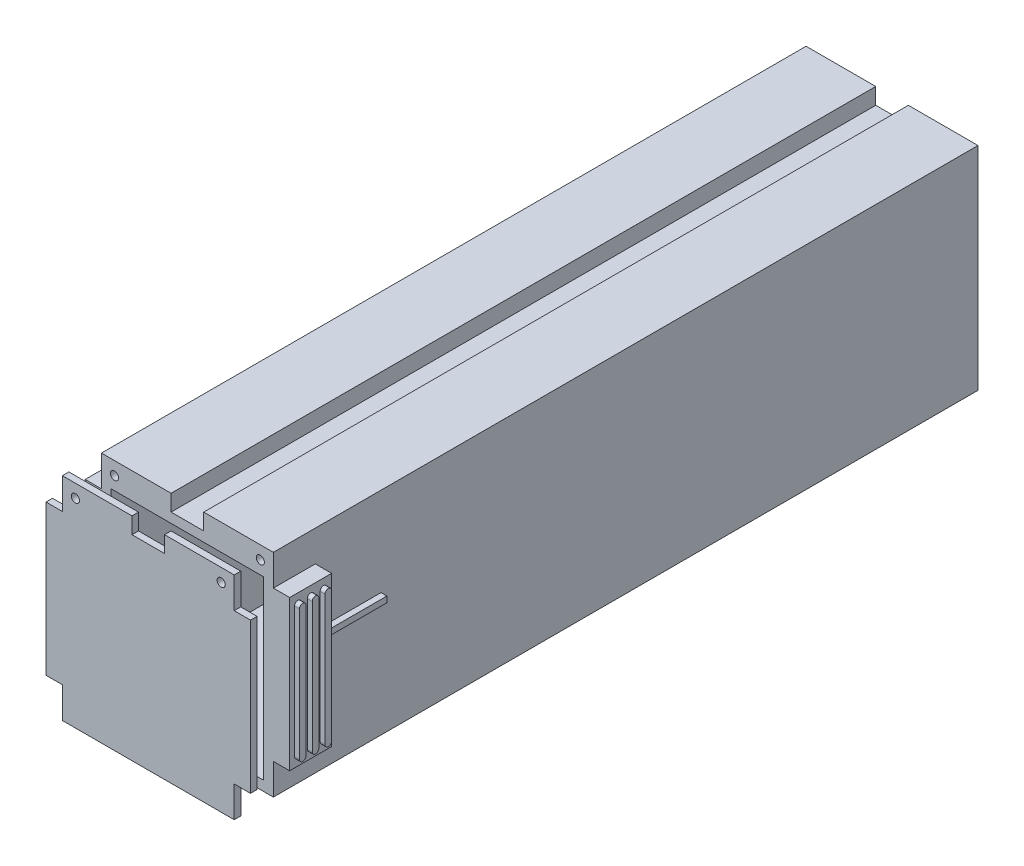
from build123d import *

# Parameters (mm, degrees)
SKETCH_1_W             = 52.7
SKETCH_1_H             = 65
EXTRUDE_1_DEPTH        = 216
SKETCH_2_W             = 10
SKETCH_2_H             = 5
CUT_EXTRUDE_1_DEPTH    = 232.642591075
SKETCH_3_W             = 46.7
SKETCH_3_H             = 54
CUT_EXTRUDE_2_DEPTH    = 211
SKETCH_6_R             = 1.75
SKETCH_6_W             = 16
SKETCH_6_H             = 16
CUT_EXTRUDE_3_DEPTH    = 5
SKETCH_7_W             = 1.8
SKETCH_7_H             = 1.8
EXTRUDE_2_DEPTH        = 33
SKETCH_9_W             = 12.85
SKETCH_9_H             = 46
EXTRUDE_3_DEPTH        = 5
SKETCH_10_W            = 12.85
SKETCH_10_H            = 46
EXTRUDE_4_DEPTH        = 5
EXTRUDE_5_DEPTH        = 1.5
EXTRUDE_START          = 1.5
EXTRUDE_6_DEPTH        = 1.5
EXTRUDE_7_DEPTH        = 2
SKETCH_15_R            = 1.25
CUT_EXTRUDE_4_DEPTH    = 20
SPLIT_START            = 57.7
SPLIT_BODIES_1_DEPTH   = 1.5
SPLIT_BODIES_1_2_DEPTH = 1.5
SPLIT_BODIES_1_3_DEPTH = 1.5
SPLIT_START_2          = -6.5
SPLIT_BODIES_1_4_DEPTH = 1.5
SPLIT_BODIES_1_5_DEPTH = 1.5
SPLIT_BODIES_1_6_DEPTH = 1.5
SPLIT_BODIES_1_7_DEPTH = 1.5
SPLIT_BODIES_1_8_DEPTH = 1.5


# Read off the part's stored shape, not the designer's step: 分割1
with BuildPart() as part:
    # 草图1 → 凸台-拉伸1 (new body)
    with BuildSketch(Plane.XY):
        with Locations((26.35, 32.5)):
            Rectangle(SKETCH_1_W, SKETCH_1_H)
    extrude(amount=EXTRUDE_1_DEPTH)

    # 草图2 → 切除-拉伸1 (cut, through all)
    with BuildSketch(Plane.XY.offset(216)):
        with Locations((26.35, 62.5)):
            Rectangle(SKETCH_2_W, SKETCH_2_H)
    extrude(amount=-CUT_EXTRUDE_1_DEPTH, mode=Mode.SUBTRACT)

    # 草图3 → 切除-拉伸2 (cut)
    with BuildSketch(Plane.XY.offset(216)):
        with Locations((26.35, 30)):
            Rectangle(SKETCH_3_W, SKETCH_3_H)
    extrude(amount=-CUT_EXTRUDE_2_DEPTH, mode=Mode.SUBTRACT)

    # 草图6 → 切除-拉伸3 (cut)
    with BuildSketch(Plane(origin=(0, 0, 0), x_dir=(-1, 0, 0), z_dir=(0, 0, -1))):
        with Locations((-13.6, 14.2)):
            Circle(SKETCH_6_R)
        with Locations((-39.1, 14.2)):
            Circle(SKETCH_6_R)
        with Locations((-26.35, 14.2)):
            Rectangle(SKETCH_6_W, SKETCH_6_H)
    extrude(amount=-CUT_EXTRUDE_3_DEPTH, mode=Mode.SUBTRACT)

    # 草图7 → 凸台-拉伸2 (add)
    with BuildSketch(Plane.XY.offset(216)):
        with Locations((53.6, 36.9)):
            Rectangle(SKETCH_7_W, SKETCH_7_H)
    extrude(amount=-EXTRUDE_2_DEPTH)

    # 草图9 → 凸台-拉伸3 (add)
    with BuildSketch(Plane.ZY):
        with Locations((209.575, 32.5)):
            Rectangle(SKETCH_9_W, SKETCH_9_H)
    extrude(amount=EXTRUDE_3_DEPTH)

    # 草图10 → 凸台-拉伸4 (add)
    with BuildSketch(Plane(origin=(52.7, 0, 0), x_dir=(0, 0, -1), z_dir=(1, 0, 0))):
        with Locations((-209.575, 32.5)):
            Rectangle(SKETCH_10_W, SKETCH_10_H)
    extrude(amount=EXTRUDE_4_DEPTH)

    # 草图11 → 凸台-拉伸5 (add)
    with BuildSketch(Plane(origin=(57.7, 0, 0), x_dir=(0, 0, -1), z_dir=(1, 0, 0))):
        with BuildLine():
            Line((-214.5, 12.5), (-214.5, 52.5))
            ThreePointArc((-214.5, 52.5), (-213.5, 53.5), (-212.5, 52.5))
            Line((-212.5, 52.5), (-212.5, 12.5))
            ThreePointArc((-212.5, 12.5), (-213.5, 11.5), (-214.5, 12.5))
        make_face()
        with BuildLine():
            Line((-210.575, 12.5), (-210.575, 52.5))
            ThreePointArc((-210.575, 52.5), (-209.575, 53.5), (-208.575, 52.5))
            Line((-208.575, 52.5), (-208.575, 12.5))
            ThreePointArc((-208.575, 12.5), (-209.575, 11.5), (-210.575, 12.5))
        make_face()
        with BuildLine():
            Line((-206.65, 12.5), (-206.65, 52.5))
            ThreePointArc((-206.65, 52.5), (-205.65, 53.5), (-204.65, 52.5))
            Line((-204.65, 52.5), (-204.65, 12.5))
            ThreePointArc((-204.65, 12.5), (-205.65, 11.5), (-206.65, 12.5))
        make_face()
    extrude(amount=EXTRUDE_5_DEPTH)

    # 草图12 → 凸台-拉伸6 (add)
    with BuildSketch(Plane.ZY.offset(5).offset(EXTRUDE_START)):
        with BuildLine():
            Line((214.5, 12.5), (214.5, 52.5))
            ThreePointArc((214.5, 52.5), (213.5, 53.5), (212.5, 52.5))
            Line((212.5, 52.5), (212.5, 12.5))
            ThreePointArc((212.5, 12.5), (213.5, 11.5), (214.5, 12.5))
        make_face()
        with BuildLine():
            Line((206.65, 12.5), (206.65, 52.5))
            ThreePointArc((206.65, 52.5), (205.65, 53.5), (204.65, 52.5))
            Line((204.65, 52.5), (204.65, 12.5))
            ThreePointArc((204.65, 12.5), (205.65, 11.5), (206.65, 12.5))
        make_face()
        with BuildLine():
            Line((210.575, 12.5), (210.575, 52.5))
            ThreePointArc((210.575, 52.5), (209.575, 53.5), (208.575, 52.5))
            Line((208.575, 52.5), (208.575, 12.5))
            ThreePointArc((208.575, 12.5), (209.575, 11.5), (210.575, 12.5))
        make_face()
    extrude(amount=-EXTRUDE_6_DEPTH)


with BuildPart() as body_2:
    # 草图14 → 凸台-拉伸7 (new body)
    with BuildSketch(Plane.XY.offset(226)):
        Polygon((57.7, 55.5), (52.7, 55.5), (52.7, 65), (31.35, 65), (31.35, 60), (21.35, 60), (21.35, 65), (0, 65), (0, 55.5), (-5, 55.5), (-5, 9.5), (0, 9.5), (0, 0), (52.7, 0), (52.7, 9.5), (57.7, 9.5), align=None)
    extrude(amount=EXTRUDE_7_DEPTH)


with BuildPart() as cut_extrude_4_tool:
    # 草图15 → 切除-拉伸4 (new body)
    with BuildSketch(Plane.XY.offset(228)):
        with Locations((4, 61)):
            Circle(SKETCH_15_R)
        with Locations((48.7, 61)):
            Circle(SKETCH_15_R)
    extrude(amount=-CUT_EXTRUDE_4_DEPTH)


with BuildPart() as part_1:
    add(part.part)

    # 切除-拉伸4: cut by cut_extrude_4_tool
    add(cut_extrude_4_tool.part, mode=Mode.SUBTRACT)

    # Split Bodies 1 7 outline → Split Bodies 1 7 (cut)
    with BuildSketch(Plane.YZ.offset(SPLIT_START_2)):
        with BuildLine():
            ThreePointArc((12.5, 214.5), (11.5, 213.5), (12.5, 212.5))
            Line((12.5, 212.5), (52.5, 212.5))
            ThreePointArc((52.5, 212.5), (53.5, 213.5), (52.5, 214.5))
            Line((52.5, 214.5), (12.5, 214.5))
        make_face()
        with BuildLine():
            ThreePointArc((12.5, 210.575), (11.5, 209.575), (12.5, 208.575))
            Line((12.5, 208.575), (52.5, 208.575))
            ThreePointArc((52.5, 208.575), (53.5, 209.575), (52.5, 210.575))
            Line((52.5, 210.575), (12.5, 210.575))
        make_face()
        with BuildLine():
            ThreePointArc((12.5, 206.65), (11.5, 205.65), (12.5, 204.65))
            Line((12.5, 204.65), (52.5, 204.65))
            ThreePointArc((52.5, 204.65), (53.5, 205.65), (52.5, 206.65))
            Line((52.5, 206.65), (12.5, 206.65))
        make_face()
    extrude(amount=SPLIT_BODIES_1_7_DEPTH, mode=Mode.SUBTRACT)

    # Split Bodies 1 8 outline → Split Bodies 1 8 (cut)
    with BuildSketch(Plane.YZ.offset(SPLIT_START)):
        with BuildLine():
            ThreePointArc((12.5, 214.5), (11.5, 213.5), (12.5, 212.5))
            Line((12.5, 212.5), (52.5, 212.5))
            ThreePointArc((52.5, 212.5), (53.5, 213.5), (52.5, 214.5))
            Line((52.5, 214.5), (12.5, 214.5))
        make_face()
        with BuildLine():
            ThreePointArc((12.5, 210.575), (11.5, 209.575), (12.5, 208.575))
            Line((12.5, 208.575), (52.5, 208.575))
            ThreePointArc((52.5, 208.575), (53.5, 209.575), (52.5, 210.575))
            Line((52.5, 210.575), (12.5, 210.575))
        make_face()
        with BuildLine():
            ThreePointArc((12.5, 206.65), (11.5, 205.65), (12.5, 204.65))
            Line((12.5, 204.65), (52.5, 204.65))
            ThreePointArc((52.5, 204.65), (53.5, 205.65), (52.5, 206.65))
            Line((52.5, 206.65), (12.5, 206.65))
        make_face()
    extrude(amount=SPLIT_BODIES_1_8_DEPTH, mode=Mode.SUBTRACT)


with BuildPart() as body_2_1:
    add(body_2.part)

    # 切除-拉伸4: cut by cut_extrude_4_tool
    add(cut_extrude_4_tool.part, mode=Mode.SUBTRACT)


with BuildPart() as body_3:
    # Split Bodies 1 outline → Split Bodies 1 (new body)
    with BuildSketch(Plane.YZ.offset(SPLIT_START)):
        with BuildLine():
            Line((12.5, 212.5), (52.5, 212.5))
            ThreePointArc((52.5, 212.5), (53.5, 213.5), (52.5, 214.5))
            Line((52.5, 214.5), (12.5, 214.5))
            ThreePointArc((12.5, 214.5), (11.5, 213.5), (12.5, 212.5))
        make_face()
    extrude(amount=SPLIT_BODIES_1_DEPTH)


with BuildPart() as body_4:
    # Split Bodies 1 2 outline → Split Bodies 1 2 (new body)
    with BuildSketch(Plane.YZ.offset(SPLIT_START)):
        with BuildLine():
            Line((12.5, 208.575), (52.5, 208.575))
            ThreePointArc((52.5, 208.575), (53.5, 209.575), (52.5, 210.575))
            Line((52.5, 210.575), (12.5, 210.575))
            ThreePointArc((12.5, 210.575), (11.5, 209.575), (12.5, 208.575))
        make_face()
    extrude(amount=SPLIT_BODIES_1_2_DEPTH)


with BuildPart() as body_5:
    # Split Bodies 1 3 outline → Split Bodies 1 3 (new body)
    with BuildSketch(Plane.YZ.offset(SPLIT_START)):
        with BuildLine():
            Line((12.5, 204.65), (52.5, 204.65))
            ThreePointArc((52.5, 204.65), (53.5, 205.65), (52.5, 206.65))
            Line((52.5, 206.65), (12.5, 206.65))
            ThreePointArc((12.5, 206.65), (11.5, 205.65), (12.5, 204.65))
        make_face()
    extrude(amount=SPLIT_BODIES_1_3_DEPTH)


with BuildPart() as body_6:
    # Split Bodies 1 4 outline → Split Bodies 1 4 (new body)
    with BuildSketch(Plane.YZ.offset(SPLIT_START_2)):
        with BuildLine():
            Line((52.5, 214.5), (12.5, 214.5))
            ThreePointArc((12.5, 214.5), (11.5, 213.5), (12.5, 212.5))
            Line((12.5, 212.5), (52.5, 212.5))
            ThreePointArc((52.5, 212.5), (53.5, 213.5), (52.5, 214.5))
        make_face()
    extrude(amount=SPLIT_BODIES_1_4_DEPTH)


with BuildPart() as body_7:
    # Split Bodies 1 5 outline → Split Bodies 1 5 (new body)
    with BuildSketch(Plane.YZ.offset(SPLIT_START_2)):
        with BuildLine():
            Line((52.5, 206.65), (12.5, 206.65))
            ThreePointArc((12.5, 206.65), (11.5, 205.65), (12.5, 204.65))
            Line((12.5, 204.65), (52.5, 204.65))
            ThreePointArc((52.5, 204.65), (53.5, 205.65), (52.5, 206.65))
        make_face()
    extrude(amount=SPLIT_BODIES_1_5_DEPTH)


with BuildPart() as body_8:
    # Split Bodies 1 6 outline → Split Bodies 1 6 (new body)
    with BuildSketch(Plane.YZ.offset(SPLIT_START_2)):
        with BuildLine():
            Line((52.5, 210.575), (12.5, 210.575))
            ThreePointArc((12.5, 210.575), (11.5, 209.575), (12.5, 208.575))
            Line((12.5, 208.575), (52.5, 208.575))
            ThreePointArc((52.5, 208.575), (53.5, 209.575), (52.5, 210.575))
        make_face()
    extrude(amount=SPLIT_BODIES_1_6_DEPTH)


solid = Compound([part_1.part, body_2_1.part, body_3.part, body_4.part, body_5.part, body_6.part, body_7.part, body_8.part])
